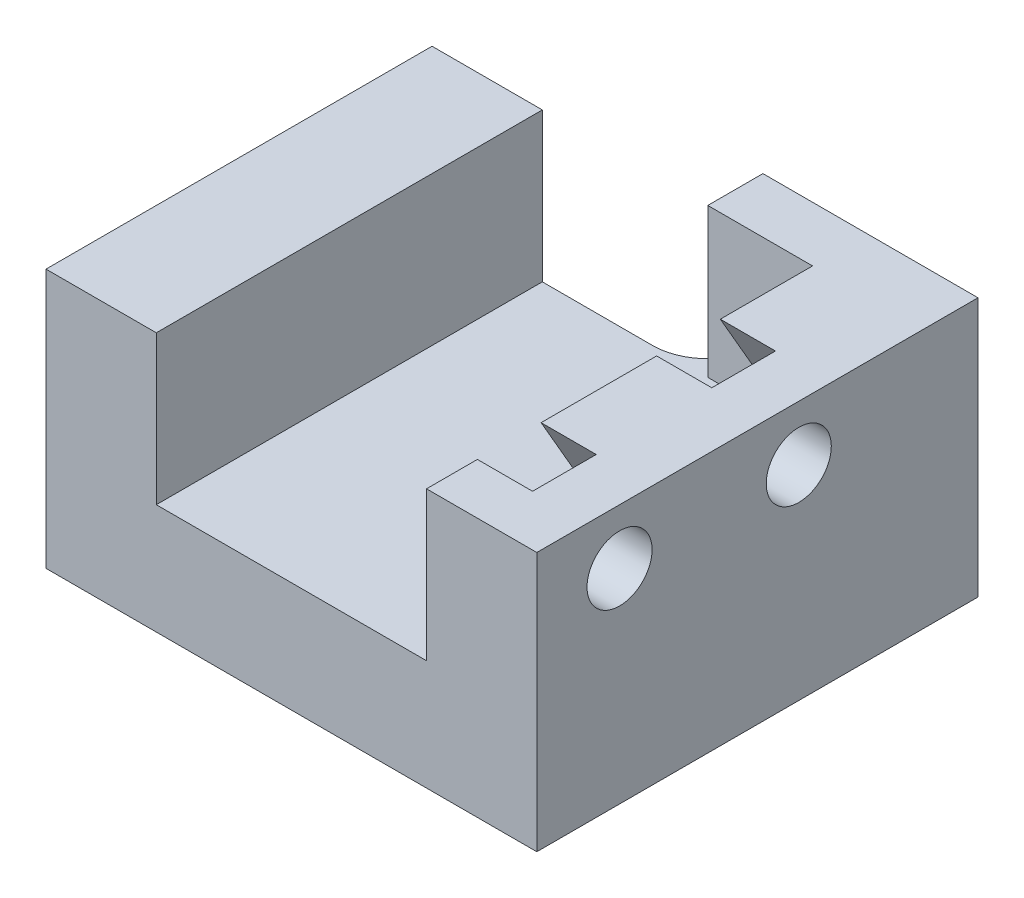
from build123d import *

# Parameters (mm, degrees)
BOSS_EXTRUDE1_DEPTH = 2
SKETCH2_W           = 2
SKETCH2_H           = 7
BOSS_EXTRUDE2_DEPTH = 2.7
CUT_EXTRUDE1_DEPTH  = 1
CUT_EXTRUDE2_REACH  = 12.656
SKETCH4_R           = 0.59
SKETCH5_W           = 3.9
SKETCH5_H           = 4.7
BOSS_EXTRUDE3_DEPTH = 1
FILLET1_R           = 1


with BuildPart() as part:
    # Sketch1 → Boss-Extrude1 (new body)
    with BuildSketch(Plane(origin=(0, 0, 0), x_dir=(1, 0, 0), z_dir=(0, 1, 0))):
        Polygon((2.075, -3.5), (2.825, -3.5), (3.825, -3.5), (4.825, -3.5), (4.825, 3.5), (3.825, 3.5), (2.825, 3.5), (2.075, 3.5), (-2.075, 3.5), (-4.075, 3.5), (-4.075, -3.5), (-2.075, -3.5), align=None)
    extrude(amount=BOSS_EXTRUDE1_DEPTH)

    # Sketch2 → Boss-Extrude2 (add)
    with BuildSketch(Plane(origin=(0, 2, 0), x_dir=(1, 0, 0), z_dir=(0, 1, 0))):
        with Locations((-3.075, 0)):
            Rectangle(SKETCH2_W, SKETCH2_H)
        with Locations((3.825, 0)):
            Rectangle(SKETCH2_W, SKETCH2_H)
    extrude(amount=BOSS_EXTRUDE2_DEPTH)

    # Sketch3 → Cut-Extrude1 (cut)
    with BuildSketch(Plane.ZY.offset(-2.825)):
        Polygon((-0.095299462, 3.7), (-0.672649731, 4.7), (-1.827350269, 4.7), (-2.404700538, 3.7), (-1.827350269, 2.7), (-0.672649731, 2.7), align=None)
        Polygon((3.154700538, 3.7), (2.577350269, 4.7), (1.422649731, 4.7), (0.845299462, 3.7), (1.422649731, 2.7), (2.577350269, 2.7), align=None)
    extrude(amount=-CUT_EXTRUDE1_DEPTH, mode=Mode.SUBTRACT)

    # Sketch4 → Cut-Extrude2 (cut, up to next)
    with BuildSketch(Plane(origin=(4.825, 0, 0), x_dir=(0, 0, -1), z_dir=(1, 0, 0)), mode=Mode.PRIVATE) as cut_extrude2_sk1:
        with Locations((-2, 3.7)):
            Circle(SKETCH4_R)
    cut_extrude2_tool1 = extrude(cut_extrude2_sk1.sketch, amount=-CUT_EXTRUDE2_REACH, mode=Mode.PRIVATE) & part.part
    # Sketch4 → Cut-Extrude2 (cut, up to next)
    with BuildSketch(Plane(origin=(4.825, 0, 0), x_dir=(0, 0, -1), z_dir=(1, 0, 0)), mode=Mode.PRIVATE) as cut_extrude2_sk2:
        with Locations((1.25, 3.7)):
            Circle(SKETCH4_R)
    cut_extrude2_tool2 = extrude(cut_extrude2_sk2.sketch, amount=-CUT_EXTRUDE2_REACH, mode=Mode.PRIVATE) & part.part
    add(cut_extrude2_tool1.solids().sort_by_distance((4.825, 3.7, 2))[0], mode=Mode.SUBTRACT)
    add(cut_extrude2_tool2.solids().sort_by_distance((4.825, 3.7, -1.25))[0], mode=Mode.SUBTRACT)

    # Sketch5 → Boss-Extrude3 (add)
    with BuildSketch(Plane(origin=(0, 0, -3.5), x_dir=(-1, 0, 0), z_dir=(0, 0, -1))):
        with Locations((-2.875, 2.35)):
            Rectangle(SKETCH5_W, SKETCH5_H)
    extrude(amount=BOSS_EXTRUDE3_DEPTH)

    # Fillet1
    fillet1_edges = [part.edges().sort_by_distance(p)[0] for p in [
        (0.925, 1, -3.5),
    ]]
    fillet(fillet1_edges, radius=FILLET1_R - 0.0001)  # a hair under: the kernel refuses the full size


solid = part.part
